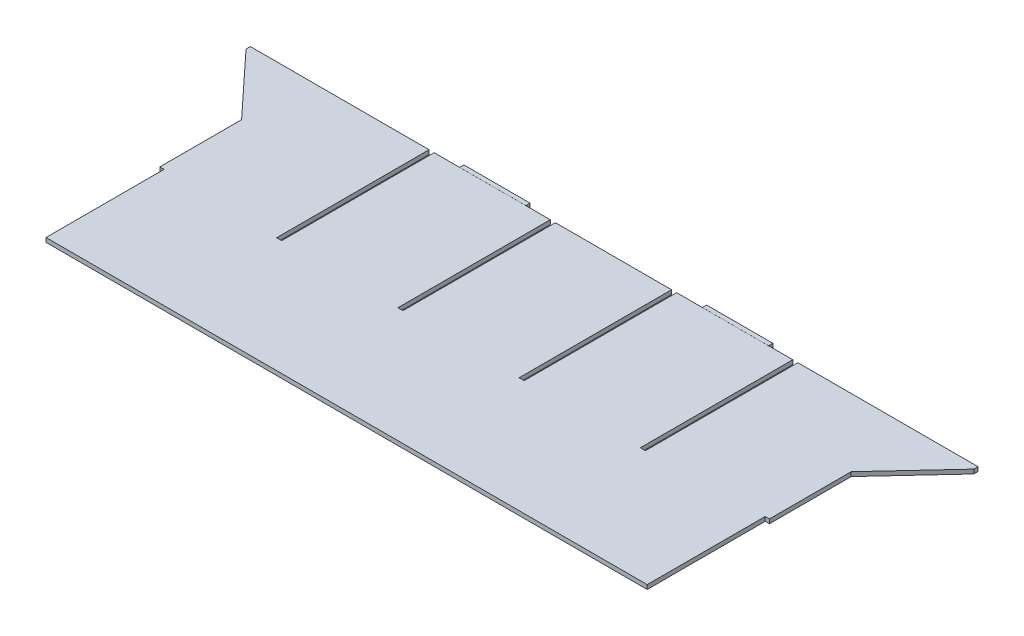
from build123d import *

# Parameters (mm, degrees)
SKETCH1_W           = 457.2230066
SKETCH1_H           = 3.175
BOSS_EXTRUDE1_DEPTH = 200.6419914
SKETCH2_W           = 3.8205
SKETCH2_H           = 114.3
CUT_EXTRUDE1_DEPTH  = 305.188278504
LPATTERN1_COUNT     = 4
LPATTERN1_PITCH     = 90.932
BOSS_EXTRUDE3_DEPTH = 3.175
SKETCH5_W           = 3.175
SKETCH5_H           = 88.514
CUT_EXTRUDE2_DEPTH  = 3.175
SKETCH3_W           = 49.658811606
SKETCH3_H           = 3.175
BOSS_EXTRUDE4_DEPTH = 3.175


with BuildPart() as part:
    # Sketch1 → Boss-Extrude1 (new body)
    with BuildSketch(Plane.XY):
        Rectangle(SKETCH1_W, SKETCH1_H)
    extrude(amount=BOSS_EXTRUDE1_DEPTH)

    # Sketch2 → Cut-Extrude1 (cut, through all)
    with BuildSketch(Plane(origin=(0, 1.5875, 0), x_dir=(1, 0, 0), z_dir=(0, 1, 0))):
        with Locations((135.8962533, -57.15)):
            Rectangle(SKETCH2_W, SKETCH2_H)
    cut_extrude1 = extrude(amount=-CUT_EXTRUDE1_DEPTH, mode=Mode.SUBTRACT)

    # LPattern1: Cut-Extrude1 ×4
    with Locations(*[(-i * LPATTERN1_PITCH, 0, 0) for i in range(1, LPATTERN1_COUNT)]):
        add(cut_extrude1, mode=Mode.SUBTRACT)

    # Sketch4 → Boss-Extrude3 (add)
    with BuildSketch(Plane.XZ.offset(1.5875)):
        Polygon((-228.6115033, 0), (-272.8865033, 0), (-272.8865033, 3.175), (-228.6115033, 50.8), align=None)
    boss_extrude3 = extrude(amount=-BOSS_EXTRUDE3_DEPTH)

    # Mirror1: Boss-Extrude3 across plane
    add(boss_extrude3.mirror(Plane(origin=(0, 0, 0), x_dir=(0, 0, 1), z_dir=(1, 0, 0))))

    # Sketch5 → Cut-Extrude2 (cut)
    with BuildSketch(Plane.XZ.offset(1.5875)):
        with Locations((-227.0240033, 156.3849914)):
            Rectangle(SKETCH5_W, SKETCH5_H)
    cut_extrude2 = extrude(amount=-CUT_EXTRUDE2_DEPTH, mode=Mode.SUBTRACT)

    # Mirror2: Cut-Extrude2 across plane
    add(cut_extrude2.mirror(Plane(origin=(0, 0, 0), x_dir=(0, 0, 1), z_dir=(1, 0, 0))), mode=Mode.SUBTRACT)

    # Sketch3 → Boss-Extrude4 (add)
    with BuildSketch(Plane(origin=(0, 0, 0), x_dir=(-1, 0, 0), z_dir=(0, 0, -1))):
        with Locations((-91.020094169, 0.029240406)):
            Rectangle(SKETCH3_W, SKETCH3_H)
        with Locations((91.020094169, 0.029240406)):
            Rectangle(SKETCH3_W, SKETCH3_H)
    extrude(amount=BOSS_EXTRUDE4_DEPTH)


solid = part.part
